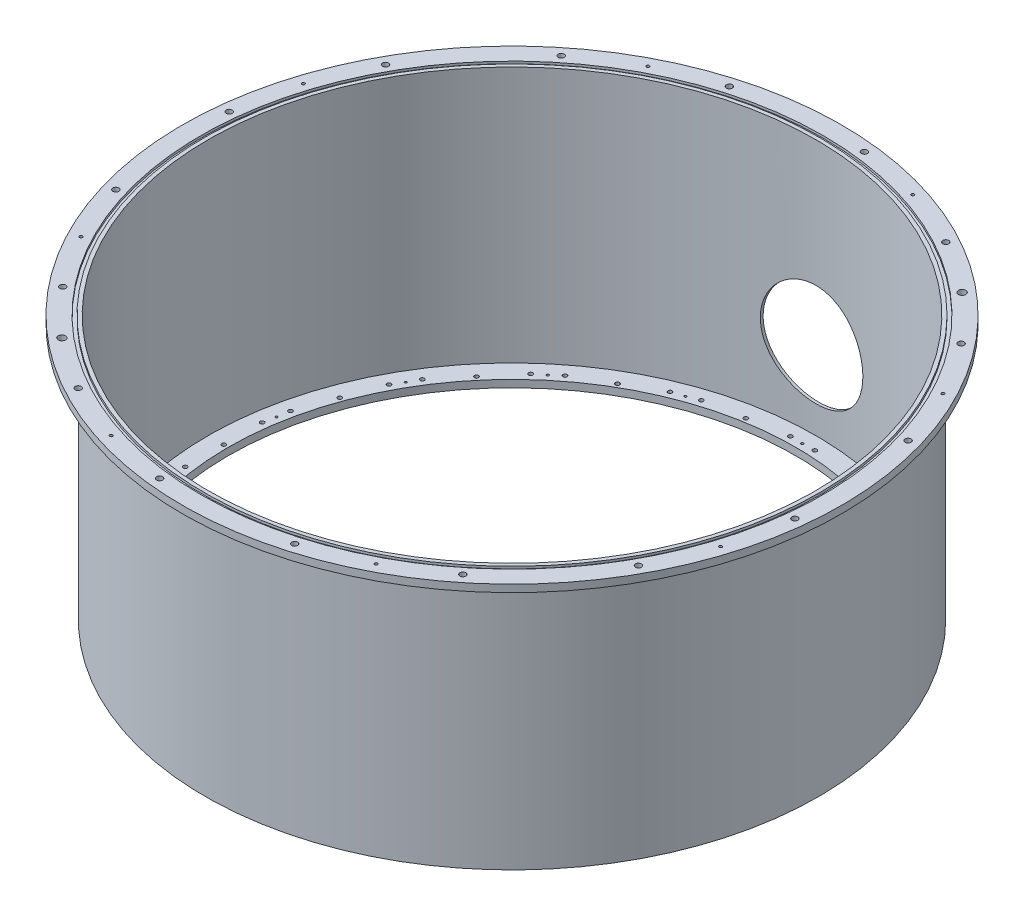
from build123d import *

# Parameters (mm, degrees)
F_1_4_CLEARANCE_HOLE_TO_RFOF_BRACKET_D    = 7.14248
CIRPATTERN_18X3_1_4_CLEARANCE_HOLES_COUNT = 18
F_10_32_TAPPED_HOLE1_D                    = 4.0386
CIRPATTERN1_COUNT                         = 18
F_13_32_0_40625_DIAMETER_HOLE2_D          = 10.31875
CIRPATTERN3_COUNT                         = 16
F_1_4_20_TAPPED_HOLE1_D                   = 5.1054
CIRPATTERN5_COUNT                         = 8
F_1_2_0_5_DIAMETER_HOLE2_D                = 12.7
CIRPATTERN7_COUNT                         = 2
SKETCH25_R                                = 88.9
CUT_EXTRUDE1_DEPTH                        = 1016
BODY_MOVE_COPY1_START                     = 444.5
BODY_MOVE_COPY1_OUTLINE_R                 = 5.159375
BODY_MOVE_COPY1_OUTLINE_R_2               = 2.5527
BODY_MOVE_COPY1_OUTLINE_R_3               = 6.35
BODY_MOVE_COPY1_DEPTH                     = 12.7
BODY_MOVE_COPY1_2_OUTLINE_R               = 5.159375
BODY_MOVE_COPY1_2_OUTLINE_R_2             = 2.5527
BODY_MOVE_COPY1_2_OUTLINE_R_3             = 6.35
BODY_MOVE_COPY1_2_DEPTH                   = 12.7
BODY_MOVE_COPY1_START_2                   = 12.6999999
BODY_MOVE_COPY1_3_OUTLINE_R               = 531.8125
BODY_MOVE_COPY1_3_OUTLINE_R_2             = 527.05
BODY_MOVE_COPY1_3_DEPTH                   = 431.8000002
BODY_MOVE_COPY1_START_3                   = -533
BODY_MOVE_COPY1_4_OUTLINE_R               = 88.9
BODY_MOVE_COPY1_4_DEPTH                   = 13.501691633


with BuildPart() as part:
    # Sketch1 → Revolve1 (revolve)
    with BuildSketch(Plane(origin=(0, 0, 0), x_dir=(0, 0, -1), z_dir=(1, 0, 0)), mode=Mode.PRIVATE) as revolve1_sk:
        Polygon((571.5, 444.5), (571.5, 457.2), (539.496, 457.2), (539.496, 453.136), (533.4, 453.136), (533.4, 457.2), (527.05, 457.2), (527.05, 12.7), (492.125, 12.7), (492.125, 0), (514.604, 0), (514.604, 4.064), (520.7, 4.064), (520.7, 0), (531.8125, 0), (531.8125, 444.5), align=None)
    revolve(revolve1_sk.sketch.rotate(Axis((0, 57.350368034, 0), (0, -1, 0)), 180), axis=Axis((0, 57.350368034, 0), (0, -1, 0)))

    # 1/4 Clearance Hole - to RFoF Bracket (through all)
    with Locations(Plane(origin=(0, 12.7, 0), x_dir=(1, 0, 0), z_dir=(0, 1, 0))):
        with Locations((-499.905299908, 66.675), (-499.905299908, -66.675), (-499.905299908, 0)):
            f_1_4_clearance_hole_to_rfof_bracket = Hole(F_1_4_CLEARANCE_HOLE_TO_RFOF_BRACKET_D / 2)

    # CirPattern-18x3-1/4 Clearance Holes: 1/4 Clearance Hole - to RFoF Bracket ×18 about axis
    cirpattern_18x3_1_4_clearance_holes_axis = Axis((0, 0, 0), (0, 1, 0))
    for i in range(1, CIRPATTERN_18X3_1_4_CLEARANCE_HOLES_COUNT):
        add(f_1_4_clearance_hole_to_rfof_bracket.rotate(cirpattern_18x3_1_4_clearance_holes_axis, i * 360 / CIRPATTERN_18X3_1_4_CLEARANCE_HOLES_COUNT), mode=Mode.SUBTRACT)

    # #10-32 Tapped Hole1 (through all)
    with Locations(Plane(origin=(0, 12.7, 0), x_dir=(1, 0, 0), z_dir=(0, 1, 0))):
        with Locations((0, 503.2375)):
            f_10_32_tapped_hole1 = Hole(F_10_32_TAPPED_HOLE1_D / 2)

    # CirPattern1: #10-32 Tapped Hole1 ×18 about axis
    cirpattern1_axis = Axis((0, 0, 0), (0, 1, 0))
    for i in range(1, CIRPATTERN1_COUNT):
        add(f_10_32_tapped_hole1.rotate(cirpattern1_axis, i * 360 / CIRPATTERN1_COUNT), mode=Mode.SUBTRACT)

    # 13/32 (0.40625) Diameter Hole2 (through all)
    with Locations(Plane(origin=(0, 457.2, 0), x_dir=(1, 0, 0), z_dir=(0, 1, 0))):
        with Locations((-553.905654078, 12.086264367)):
            f_13_32_0_40625_diameter_hole2 = Hole(F_13_32_0_40625_DIAMETER_HOLE2_D / 2)

    # CirPattern3: 13/32 (0.40625) Diameter Hole2 ×16 about axis
    cirpattern3_axis = Axis((0, 0, 0), (0, 1, 0))
    for i in range(1, CIRPATTERN3_COUNT):
        add(f_13_32_0_40625_diameter_hole2.rotate(cirpattern3_axis, i * 360 / CIRPATTERN3_COUNT), mode=Mode.SUBTRACT)

    # 1/4-20 Tapped Hole1 (through all)
    with Locations(Plane(origin=(0, 457.2, 0), x_dir=(1, 0, 0), z_dir=(0, 1, 0))):
        with Locations((-540.904599045, 119.915662607)):
            f_1_4_20_tapped_hole1 = Hole(F_1_4_20_TAPPED_HOLE1_D / 2)

    # CirPattern5: 1/4-20 Tapped Hole1 ×8 about axis
    cirpattern5_axis = Axis((0, 0, 0), (0, 1, 0))
    for i in range(1, CIRPATTERN5_COUNT):
        add(f_1_4_20_tapped_hole1.rotate(cirpattern5_axis, i * 360 / CIRPATTERN5_COUNT), mode=Mode.SUBTRACT)

    # 1/2 (0.5) Diameter Hole2 (through all)
    with Locations(Plane(origin=(0, 457.2, 0), x_dir=(1, 0, 0), z_dir=(0, 1, 0))):
        with Locations((-545.62042546, -96.207602234)):
            f_1_2_0_5_diameter_hole2 = Hole(F_1_2_0_5_DIAMETER_HOLE2_D / 2)

    # CirPattern7: 1/2 (0.5) Diameter Hole2 ×2 about axis
    cirpattern7_axis = Axis((0, 0, 0), (0, 1, 0))
    for i in range(1, CIRPATTERN7_COUNT):
        add(f_1_2_0_5_diameter_hole2.rotate(cirpattern7_axis, i * 360 / CIRPATTERN7_COUNT), mode=Mode.SUBTRACT)

    # Sketch25 → Cut-Extrude1 (cut)
    with BuildSketch(Plane(origin=(0, 0, 0), x_dir=(-0.7660444431189817, 0, -0.642787609686535), z_dir=(0.642787609686535, 0, -0.7660444431189817))):
        with Locations((0, 149.4750122)):
            Circle(SKETCH25_R)
    extrude(amount=-CUT_EXTRUDE1_DEPTH, mode=Mode.SUBTRACT)

    # Body-Move/Copy1: read off the stored shape, not the designer's step
    # Body-Move/Copy1 outline → Body-Move/Copy1 (cut)
    with BuildSketch(Plane(origin=(0, 0, 0), x_dir=(1, 0, 0), z_dir=(0, 1, 0)).offset(BODY_MOVE_COPY1_START)):
        with Locations((432.085249302, 346.78507572)):
            Circle(BODY_MOVE_COPY1_OUTLINE_R)
        with Locations((266.48581506, 485.739499915)):
            Circle(BODY_MOVE_COPY1_OUTLINE_R)
        with Locations((60.316331176, 550.744488488)):
            Circle(BODY_MOVE_COPY1_OUTLINE_R)
        with Locations((-155.035767361, 531.903621199)):
            Circle(BODY_MOVE_COPY1_OUTLINE_R)
        with Locations((-346.78507572, 432.085249302)):
            Circle(BODY_MOVE_COPY1_OUTLINE_R)
        with Locations((-485.739499915, 266.48581506)):
            Circle(BODY_MOVE_COPY1_OUTLINE_R)
        with Locations((-550.744488488, 60.316331176)):
            Circle(BODY_MOVE_COPY1_OUTLINE_R)
        with Locations((-531.903621199, -155.035767361)):
            Circle(BODY_MOVE_COPY1_OUTLINE_R)
        with Locations((-432.085249302, -346.78507572)):
            Circle(BODY_MOVE_COPY1_OUTLINE_R)
        with Locations((-266.48581506, -485.739499915)):
            Circle(BODY_MOVE_COPY1_OUTLINE_R)
        with Locations((-60.316331176, -550.744488488)):
            Circle(BODY_MOVE_COPY1_OUTLINE_R)
        with Locations((155.035767361, -531.903621199)):
            Circle(BODY_MOVE_COPY1_OUTLINE_R)
        with Locations((346.78507572, -432.085249302)):
            Circle(BODY_MOVE_COPY1_OUTLINE_R)
        with Locations((485.739499915, -266.48581506)):
            Circle(BODY_MOVE_COPY1_OUTLINE_R)
        with Locations((550.744488488, -60.316331176)):
            Circle(BODY_MOVE_COPY1_OUTLINE_R)
        with Locations((531.903621199, 155.035767361)):
            Circle(BODY_MOVE_COPY1_OUTLINE_R)
        with Locations((491.437264487, 255.826047305)):
            Circle(BODY_MOVE_COPY1_OUTLINE_R_2)
        with Locations((166.602289393, 528.3949551)):
            Circle(BODY_MOVE_COPY1_OUTLINE_R_2)
        with Locations((-255.826047305, 491.437264487)):
            Circle(BODY_MOVE_COPY1_OUTLINE_R_2)
        with Locations((-528.3949551, 166.602289393)):
            Circle(BODY_MOVE_COPY1_OUTLINE_R_2)
        with Locations((-491.437264487, -255.826047305)):
            Circle(BODY_MOVE_COPY1_OUTLINE_R_2)
        with Locations((-166.602289393, -528.3949551)):
            Circle(BODY_MOVE_COPY1_OUTLINE_R_2)
        with Locations((255.826047305, -491.437264487)):
            Circle(BODY_MOVE_COPY1_OUTLINE_R_2)
        with Locations((528.3949551, -166.602289393)):
            Circle(BODY_MOVE_COPY1_OUTLINE_R_2)
        with Locations((356.128440302, 424.417348155)):
            Circle(BODY_MOVE_COPY1_OUTLINE_R_3)
        with Locations((-356.128440302, -424.417348155)):
            Circle(BODY_MOVE_COPY1_OUTLINE_R_3)
    extrude(amount=BODY_MOVE_COPY1_DEPTH, mode=Mode.SUBTRACT)

    # Body-Move_Copy1 2 outline → Body-Move_Copy1 2 (add)
    with BuildSketch(Plane(origin=(0, 0, 0), x_dir=(1, 0, 0), z_dir=(0, 1, 0)).offset(BODY_MOVE_COPY1_START)):
        with Locations((-553.905654078, 12.086264367)):
            Circle(BODY_MOVE_COPY1_2_OUTLINE_R)
        with Locations((-516.367309878, -200.804264636)):
            Circle(BODY_MOVE_COPY1_2_OUTLINE_R)
        with Locations((-400.21672363, -383.124164643)):
            Circle(BODY_MOVE_COPY1_2_OUTLINE_R)
        with Locations((-223.136769183, -507.116883613)):
            Circle(BODY_MOVE_COPY1_2_OUTLINE_R)
        with Locations((-12.086264367, -553.905654078)):
            Circle(BODY_MOVE_COPY1_2_OUTLINE_R)
        with Locations((200.804264636, -516.367309878)):
            Circle(BODY_MOVE_COPY1_2_OUTLINE_R)
        with Locations((383.124164643, -400.21672363)):
            Circle(BODY_MOVE_COPY1_2_OUTLINE_R)
        with Locations((507.116883613, -223.136769183)):
            Circle(BODY_MOVE_COPY1_2_OUTLINE_R)
        with Locations((553.905654078, -12.086264367)):
            Circle(BODY_MOVE_COPY1_2_OUTLINE_R)
        with Locations((516.367309878, 200.804264636)):
            Circle(BODY_MOVE_COPY1_2_OUTLINE_R)
        with Locations((400.21672363, 383.124164643)):
            Circle(BODY_MOVE_COPY1_2_OUTLINE_R)
        with Locations((223.136769183, 507.116883613)):
            Circle(BODY_MOVE_COPY1_2_OUTLINE_R)
        with Locations((12.086264367, 553.905654078)):
            Circle(BODY_MOVE_COPY1_2_OUTLINE_R)
        with Locations((-200.804264636, 516.367309878)):
            Circle(BODY_MOVE_COPY1_2_OUTLINE_R)
        with Locations((-383.124164643, 400.21672363)):
            Circle(BODY_MOVE_COPY1_2_OUTLINE_R)
        with Locations((-507.116883613, 223.136769183)):
            Circle(BODY_MOVE_COPY1_2_OUTLINE_R)
        with Locations((-540.904599045, 119.915662607)):
            Circle(BODY_MOVE_COPY1_2_OUTLINE_R_2)
        with Locations((-467.27048816, -297.684131759)):
            Circle(BODY_MOVE_COPY1_2_OUTLINE_R_2)
        with Locations((-119.915662607, -540.904599045)):
            Circle(BODY_MOVE_COPY1_2_OUTLINE_R_2)
        with Locations((297.684131759, -467.27048816)):
            Circle(BODY_MOVE_COPY1_2_OUTLINE_R_2)
        with Locations((540.904599045, -119.915662607)):
            Circle(BODY_MOVE_COPY1_2_OUTLINE_R_2)
        with Locations((467.27048816, 297.684131759)):
            Circle(BODY_MOVE_COPY1_2_OUTLINE_R_2)
        with Locations((119.915662607, 540.904599045)):
            Circle(BODY_MOVE_COPY1_2_OUTLINE_R_2)
        with Locations((-297.684131759, 467.27048816)):
            Circle(BODY_MOVE_COPY1_2_OUTLINE_R_2)
        with Locations((-545.62042546, -96.207602234)):
            Circle(BODY_MOVE_COPY1_2_OUTLINE_R_3)
        with Locations((545.62042546, 96.207602234)):
            Circle(BODY_MOVE_COPY1_2_OUTLINE_R_3)
    extrude(amount=BODY_MOVE_COPY1_2_DEPTH)

    # Body-Move_Copy1 3 outline → Body-Move_Copy1 3 (add)
    with BuildSketch(Plane(origin=(0, 0, 0), x_dir=(1, 0, 0), z_dir=(0, 1, 0)).offset(BODY_MOVE_COPY1_START_2)):
        Circle(BODY_MOVE_COPY1_3_OUTLINE_R)
        Circle(BODY_MOVE_COPY1_3_OUTLINE_R_2, mode=Mode.SUBTRACT)
    extrude(amount=BODY_MOVE_COPY1_3_DEPTH)

    # Body-Move_Copy1 4 outline → Body-Move_Copy1 4 (cut)
    with BuildSketch(Plane.XY.offset(BODY_MOVE_COPY1_START_3)):
        with Locations((0, 149.4750122)):
            Circle(BODY_MOVE_COPY1_4_OUTLINE_R)
    extrude(amount=BODY_MOVE_COPY1_4_DEPTH, mode=Mode.SUBTRACT)


solid = part.part
